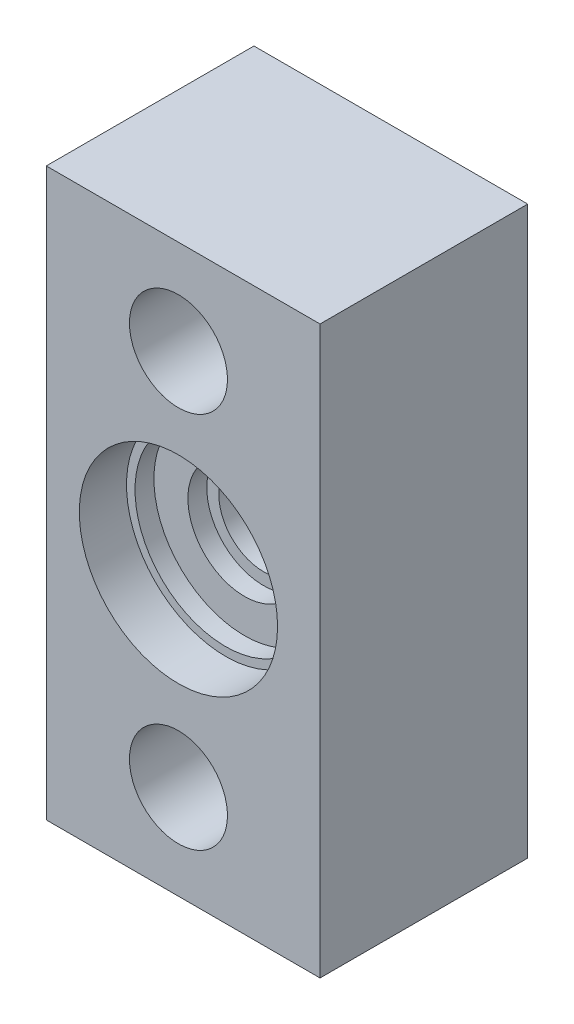
from build123d import *

# Parameters (mm, degrees)
SKETCH1_W               = 15
SKETCH1_H               = 30
BOSS_EXTRUDE1_DEPTH     = 6
SKETCH2_R               = 5.25
CUT_EXTRUDE1_DEPTH      = 2.5
SKETCH4_R               = 4.8
CUT_EXTRUDE3_DEPTH      = 1
CUT_EXTRUDE4_DEPTH      = 18.131841699
CUT_EXTRUDE4_DEPTH_BACK = 5
SKETCH5_R               = 2.36
CUT_EXTRUDE6_DEPTH      = 18.811513131
CUT_EXTRUDE6_DEPTH_BACK = 18.811513131
SKETCH11_W              = 14.5
SKETCH11_H              = 30
BOSS_EXTRUDE5_DEPTH     = 5
SKETCH12_R              = 4
CUT_EXTRUDE8_DEPTH      = 5
SKETCH13_R              = 2.595
CUT_EXTRUDE9_DEPTH      = 21.05617112
SKETCH14_R              = 3
CUT_EXTRUDE10_DEPTH     = 1


with BuildPart() as part:
    # Sketch1 → Boss-Extrude1 (new body)
    with BuildSketch(Plane.XY):
        Rectangle(SKETCH1_W, SKETCH1_H)
    extrude(amount=BOSS_EXTRUDE1_DEPTH)

    # Sketch2 → Cut-Extrude1 (cut)
    with BuildSketch(Plane.XY.offset(6)):
        Circle(SKETCH2_R)
    extrude(amount=-CUT_EXTRUDE1_DEPTH, mode=Mode.SUBTRACT)

    # Sketch4 → Cut-Extrude3 (cut)
    with BuildSketch(Plane.XY.offset(3.5)):
        Circle(SKETCH4_R)
    extrude(amount=-CUT_EXTRUDE3_DEPTH, mode=Mode.SUBTRACT)

    # Sketch5 → Cut-Extrude4 (cut, two sides: drawn at the far end of the back side and taken through both)
    with BuildSketch(Plane.XY.offset(2.5).offset(-CUT_EXTRUDE4_DEPTH_BACK)):
        Circle(SKETCH5_R)
    extrude(amount=CUT_EXTRUDE4_DEPTH + CUT_EXTRUDE4_DEPTH_BACK, mode=Mode.SUBTRACT)

    # Sketch6 → Cut-Extrude6 (cut, two sides: drawn at the far end of the back side and taken through both)
    with BuildSketch(Plane.XY.offset(-CUT_EXTRUDE6_DEPTH_BACK)):
        Polygon((-7, 91.640828326), (-7, 15), (-7, -15), (-7, -91.640828326), (-160.281656652, -91.640828326), (-160.281656652, 91.640828326), align=None)
    extrude(amount=CUT_EXTRUDE6_DEPTH + CUT_EXTRUDE6_DEPTH_BACK, mode=Mode.SUBTRACT)

    # Sketch11 → Boss-Extrude5 (add)
    with BuildSketch(Plane(origin=(0, 0, 0), x_dir=(-1, 0, 0), z_dir=(0, 0, -1))):
        with Locations((-0.25, 0)):
            Rectangle(SKETCH11_W, SKETCH11_H)
    extrude(amount=BOSS_EXTRUDE5_DEPTH)

    # Sketch12 → Cut-Extrude8 (cut)
    with BuildSketch(Plane(origin=(0, 0, -5), x_dir=(-1, 0, 0), z_dir=(0, 0, -1))):
        Circle(SKETCH12_R)
    extrude(amount=-CUT_EXTRUDE8_DEPTH, mode=Mode.SUBTRACT)

    # Sketch13 → Cut-Extrude9 (cut, through all)
    with BuildSketch(Plane(origin=(0, 0, -5), x_dir=(-1, 0, 0), z_dir=(0, 0, -1))):
        with Locations((0, -10)):
            Circle(SKETCH13_R)
        with Locations((0, 10)):
            Circle(SKETCH13_R)
    extrude(amount=-CUT_EXTRUDE9_DEPTH, mode=Mode.SUBTRACT)

    # Sketch14 → Cut-Extrude10 (cut)
    with BuildSketch(Plane.XY.offset(2.5)):
        Circle(SKETCH14_R)
    extrude(amount=-CUT_EXTRUDE10_DEPTH, mode=Mode.SUBTRACT)


solid = part.part
